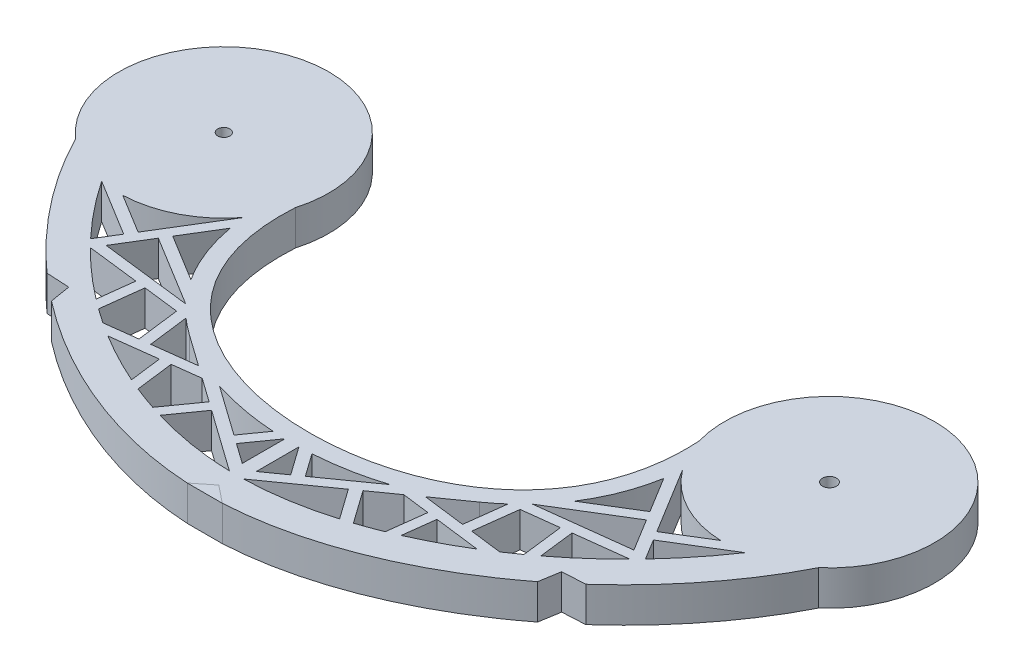
from build123d import *

# Parameters (mm, degrees)
BOSS_EXTRUDE7_DEPTH  = 10
CUT_EXTRUDE1_REACH   = 157.215
SKETCH9_R            = 1.75
SKETCH9_R_2          = 2
CUT_EXTRUDE2_DEPTH   = 3
CUT_EXTRUDE3_REACH   = 157.215
CUT_EXTRUDE4_START   = -10
CUT_EXTRUDE4_DEPTH   = 10
BOSS_EXTRUDE9_START  = -10
BOSS_EXTRUDE9_DEPTH  = 10
BOSS_EXTRUDE10_DEPTH = 10


# Read off the part's stored shape, not the designer's step: Cut-Extrude4, Boss-Extrude9
with BuildPart() as part:
    # Sketch7 → Boss-Extrude7 (new body)
    with BuildSketch(Plane(origin=(-18.136895005, 0, 47.715926566), x_dir=(1, 0, 0), z_dir=(0, 1, 0))):
        with BuildLine():
            ThreePointArc((-39.552837235, 29.351210073), (-76.890563323, 66.478444807), (-87.958625782, 14.999950833))
            add(Edge.make_bspline(
                [(-87.958625782, 14.999950833), (-68.922895336, -22.651065451), (18.136895107, -86.06931395), (105.196685549, -22.651065451), (124.232415996, 14.999950833)],
                knots=[0, 0, 0, 0, 0.5, 1, 1, 1, 1], degree=3))
            ThreePointArc((124.232415996, 14.999950833), (113.164353536, 66.478444807), (75.826627449, 29.351210073))
            add(Edge.make_bspline(
                [(-39.552837235, 29.351210073), (-41.848753724, -7.44696631), (18.136895086, -41.273411133), (78.122543939, -7.446966334), (75.826627449, 29.351210073)],
                knots=[0, 0, 0, 0, 0.5, 1, 1, 1, 1], degree=3))
        make_face()
    extrude(amount=BOSS_EXTRUDE7_DEPTH)

    # Sketch9 → Cut-Extrude1 (cut, up to next)
    with BuildSketch(Plane(origin=(0, 10, 0), x_dir=(1, 0, 0), z_dir=(0, 1, 0)), mode=Mode.PRIVATE) as cut_extrude1_sk1:
        with Locations(Location((-86.499999796, -9.999999921, 0), (0, 0, 270))):
            Circle(SKETCH9_R)
    cut_extrude1_tool1 = extrude(cut_extrude1_sk1.sketch, amount=-CUT_EXTRUDE1_REACH, mode=Mode.PRIVATE) & part.part
    # Sketch9 → Cut-Extrude1 (cut, up to next)
    with BuildSketch(Plane(origin=(0, 10, 0), x_dir=(1, 0, 0), z_dir=(0, 1, 0)), mode=Mode.PRIVATE) as cut_extrude1_sk2:
        with Locations(Location((86.5, -9.999999921, 0), (0, 0, 270))):
            Circle(SKETCH9_R_2)
    cut_extrude1_tool2 = extrude(cut_extrude1_sk2.sketch, amount=-CUT_EXTRUDE1_REACH, mode=Mode.PRIVATE) & part.part
    add(cut_extrude1_tool1.solids().sort_by_distance((-86.5, 10, 10))[0], mode=Mode.SUBTRACT)
    add(cut_extrude1_tool2.solids().sort_by_distance((86.5, 10, 10))[0], mode=Mode.SUBTRACT)

    # Sketch10 → Cut-Extrude2 (cut)
    with BuildSketch(Plane.XZ):
        Polygon((-91.11880195, 9.999999921), (-88.809400873, 5.999999921), (-84.190598719, 5.999999921), (-81.881197643, 9.999999921), (-84.190598719, 13.999999921), (-88.809400873, 13.999999921), align=None)
        Polygon((81.881197846, 9.999999921), (84.190598923, 5.999999921), (88.809401077, 5.999999921), (91.118802154, 9.999999921), (88.809401077, 13.999999921), (84.190598923, 13.999999921), align=None)
    extrude(amount=-CUT_EXTRUDE2_DEPTH, mode=Mode.SUBTRACT)

    # Sketch12 → Cut-Extrude3 (cut, up to next)
    with BuildSketch(Plane(origin=(0, 10, 0), x_dir=(1, 0, 0), z_dir=(0, 1, 0)), mode=Mode.PRIVATE) as cut_extrude3_sk1:
        with BuildLine():
            add(Edge.make_bspline(
                [(3.4e-08, -102.076116267), (1.667125354, -102.076116268), (3.334250674, -102.029606358), (5.000000038, -101.93803401)],
                knots=[0.5, 0.5, 0.5, 0.5, 0.5191492, 0.5191492, 0.5191492, 0.5191492], degree=3))
            Line((5.000000102, -101.938034007), (0, -97.938034007))
            Line((0, -97.938034007), (-4.999999898, -101.938034007))
            add(Edge.make_bspline(
                [(-4.999999898, -101.938034007), (-3.334250535, -102.029606357), (-1.667125251, -102.076116266), (3.4e-08, -102.076116267)],
                knots=[0.4808508, 0.4808508, 0.4808508, 0.4808508, 0.5, 0.5, 0.5, 0.5], degree=3))
        make_face()
    cut_extrude3_tool1 = extrude(cut_extrude3_sk1.sketch, amount=-CUT_EXTRUDE3_REACH, mode=Mode.PRIVATE) & part.part
    # Sketch12 → Cut-Extrude3 (cut, up to next)
    with BuildSketch(Plane(origin=(0, 10, 0), x_dir=(1, 0, 0), z_dir=(0, 1, 0)), mode=Mode.PRIVATE) as cut_extrude3_sk2:
        with BuildLine():
            Line((70.404630398, -70.404630398), (69.422644404, -76.312201038))
            add(Edge.make_bspline(
                [(69.422644404, -76.312201038), (72.006013328, -74.313002574), (74.516828912, -72.224047487), (76.945806504, -70.055102994)],
                knots=[0.782767442, 0.782767442, 0.782767442, 0.782767442, 0.818953202, 0.818953202, 0.818953202, 0.818953202], degree=3))
            Line((76.945806504, -70.055102994), (70.404630398, -70.404630398))
        make_face()
    cut_extrude3_tool2 = extrude(cut_extrude3_sk2.sketch, amount=-CUT_EXTRUDE3_REACH, mode=Mode.PRIVATE) & part.part
    # Sketch12 → Cut-Extrude3 (cut, up to next)
    with BuildSketch(Plane(origin=(0, 10, 0), x_dir=(1, 0, 0), z_dir=(0, 1, 0)), mode=Mode.PRIVATE) as cut_extrude3_sk3:
        with BuildLine():
            add(Edge.make_bspline(
                [(-76.945525012, -70.055354169), (-74.51654085, -72.224292711), (-72.005719037, -74.313241453), (-69.42234423, -76.312433176)],
                knots=[0.181048195, 0.181048195, 0.181048195, 0.181048195, 0.217233958, 0.217233958, 0.217233958, 0.217233958], degree=3))
            Line((-69.42234423, -76.312433176), (-70.404630305, -70.404630305))
            Line((-70.404630305, -70.404630305), (-76.945525012, -70.055354169))
        make_face()
    cut_extrude3_tool3 = extrude(cut_extrude3_sk3.sketch, amount=-CUT_EXTRUDE3_REACH, mode=Mode.PRIVATE) & part.part
    add(cut_extrude3_tool1.solids().sort_by_distance((0, 10, 100.665729))[0], mode=Mode.SUBTRACT)
    add(cut_extrude3_tool2.solids().sort_by_distance((72.284667, 10, 72.284435))[0], mode=Mode.SUBTRACT)
    add(cut_extrude3_tool3.solids().sort_by_distance((-72.284471, 10, 72.284598))[0], mode=Mode.SUBTRACT)

    # Cut-Extrude4 outline → Cut-Extrude4 (cut)
    with BuildSketch(Plane(origin=(0, 10, 0), x_dir=(1, 0, 0), z_dir=(0, 1, 0)).offset(CUT_EXTRUDE4_START)):
        with BuildLine():
            add(Edge.make_bspline(
                [(-62.548029668, -28.063492503), (-62.420996014, -29.418691097), (-61.960340191, -32.984818186), (-60.700717471, -38.475582927), (-58.550123564, -44.365643648), (-55.757526452, -49.774975806), (-51.258953922, -56.32630085), (-44.34683122, -63.248244472), (-34.509934137, -69.548404664), (-19.93792091, -75.400346503), (1.02e-07, -78.193733391), (19.937921114, -75.400346504), (34.50993434, -69.548404665), (44.346831423, -63.248244472), (51.258954126, -56.326300851), (55.757526656, -49.774975806), (58.550123767, -44.365643649), (60.700717674, -38.475582927), (61.960340395, -32.984818186), (62.420996217, -29.418691097), (62.548029872, -28.063492504)],
                knots=[0.043895539, 0.043895539, 0.043895539, 0.043895539, 0.0625, 0.09375, 0.125, 0.15625, 0.1875, 0.25, 0.3125, 0.375, 0.5, 0.625, 0.6875, 0.75, 0.8125, 0.84375, 0.875, 0.90625, 0.9375, 0.956104461, 0.956104461, 0.956104461, 0.956104461], degree=3))
            ThreePointArc((-62.548029668, -28.063492503), (-75.592334586, -37.946546701), (-91.88267132, -39.5129375))
            add(Edge.make_bspline(
                [(-91.88267132, -39.5129375), (-91.655822009, -39.851586045), (-90.004404189, -42.28867412), (-86.726494545, -46.751749001), (-80.05790908, -54.718890052), (-70.683342588, -64.025971484), (-58.066702471, -73.829661616), (-44.383796741, -81.958439403), (-29.94274555, -88.114356187), (-15.039263517, -92.015520635), (9.5e-08, -93.399252924), (15.039263711, -92.01552063), (29.942745747, -88.114356182), (44.383796942, -81.958439398), (58.066702676, -73.829661613), (70.683342795, -64.025971483), (80.057909288, -54.718890053), (86.726494752, -46.751749003), (90.004404396, -42.288674121), (91.655822216, -39.851586046), (91.882671528, -39.5129375)],
                knots=[0.057469583, 0.057469583, 0.057469583, 0.057469583, 0.0625, 0.09375, 0.125, 0.1875, 0.25, 0.3125, 0.375, 0.4375, 0.5, 0.5625, 0.625, 0.6875, 0.75, 0.8125, 0.875, 0.90625, 0.9375, 0.942530417, 0.942530417, 0.942530417, 0.942530417], degree=3))
            ThreePointArc((91.882671528, -39.5129375), (75.592334792, -37.946546702), (62.548029872, -28.063492504))
        make_face()
    extrude(amount=CUT_EXTRUDE4_DEPTH, mode=Mode.SUBTRACT)

    # Boss-Extrude9 outline → Boss-Extrude9 (add)
    with BuildSketch(Plane.XZ.offset(BOSS_EXTRUDE9_START)):
        with BuildLine():
            add(Edge.make_bspline(
                [(61.910673514, 32.76758616), (61.953077476, 32.530509461), (62.2176064, 30.993215728), (62.420996217, 29.418691097), (62.548029872, 28.063492504)],
                knots=[0.934092605, 0.934092605, 0.934092605, 0.934092605, 0.9375, 0.956104461, 0.956104461, 0.956104461, 0.956104461], degree=3))
            Line((62.548029872, 28.063492504), (70.312543244, 40.744221841))
            Line((70.312543244, 40.744221841), (67.860554837, 42.48472245))
            Line((67.860554837, 42.48472245), (61.910673514, 32.76758616))
        make_face()
        with BuildLine():
            Line((67.860554837, 42.48472245), (70.312543244, 40.744221841))
            Line((70.312543244, 40.744221841), (71.882737903, 43.308608368))
            Line((71.882737903, 43.308608368), (63.059802029, 49.571413368))
            Line((63.059802029, 49.571413368), (49.524010805, 57.859488104))
            add(Edge.make_bspline(
                [(49.524010805, 57.859488104), (50.491241977, 56.818898763), (52.013790041, 55.034628627), (53.413433174, 53.129522246), (53.941879538, 52.364647964)],
                knots=[0.789770891, 0.789770891, 0.789770891, 0.789770891, 0.8125, 0.827144885, 0.827144885, 0.827144885, 0.827144885], degree=3))
            Line((53.941879538, 52.364647964), (61.406362532, 47.066116718))
            Line((61.406362532, 47.066116718), (68.140869962, 42.942523223))
            Line((68.140869962, 42.942523223), (67.860554837, 42.48472245))
        make_face()
        with BuildLine():
            Line((63.059802029, 49.571413368), (71.882737903, 43.308608368))
            Line((71.882737903, 43.308608368), (74.079486631, 46.896260897))
            Line((74.079486631, 46.896260897), (85.376924602, 39.978748043))
            ThreePointArc((85.376924602, 39.978748043), (88.642494962, 39.923174095), (91.882671528, 39.5129375))
            Line((91.882671528, 39.5129375), (75.646065835, 49.454742791))
            Line((75.646065835, 49.454742791), (79.238009146, 55.320977897))
            add(Edge.make_bspline(
                [(77.085158054, 57.550018933), (77.812810631, 56.814476331), (78.530552386, 56.071326563), (79.238009146, 55.320977897)],
                knots=[0.848457328, 0.848457328, 0.848457328, 0.848457328, 0.860751313, 0.860751313, 0.860751313, 0.860751313], degree=3))
            Line((77.085158054, 57.550018933), (62.30055363, 59.337027727))
            Line((62.30055363, 59.337027727), (63.526406136, 69.478972429))
            add(Edge.make_bspline(
                [(60.753613666, 71.539393839), (61.686928783, 70.865010822), (62.61136355, 70.178027853), (63.526406136, 69.478972429)],
                knots=[0.763740362, 0.763740362, 0.763740362, 0.763740362, 0.777297489, 0.777297489, 0.777297489, 0.777297489], degree=3))
            Line((60.753613666, 71.539393839), (59.322230581, 59.697016356))
            Line((59.322230581, 59.697016356), (49.059623661, 60.937453251))
            Line((49.059623661, 60.937453251), (47.521689417, 73.218979202))
            Line((47.521689417, 73.218979202), (56.678688826, 74.365649657))
            add(Edge.make_bspline(
                [(52.720969648, 76.89348052), (54.054428795, 76.076490632), (55.374110034, 75.233453407), (56.678688826, 74.365649657)],
                knots=[0.725802392, 0.725802392, 0.725802392, 0.725802392, 0.744268631, 0.744268631, 0.744268631, 0.744268631], degree=3))
            Line((52.720969648, 76.89348052), (39.644319543, 75.255978138))
            Line((39.644319543, 75.255978138), (38.504682603, 84.356809797))
            add(Edge.make_bspline(
                [(35.312430399, 85.704979344), (36.38137701, 85.272992874), (37.445639574, 84.823432873), (38.504682603, 84.356809797)],
                knots=[0.648350173, 0.648350173, 0.648350173, 0.648350173, 0.662192937, 0.662192937, 0.662192937, 0.662192937], degree=3))
            Line((35.312430399, 85.704979344), (36.667567826, 74.883219214))
            Line((36.667567826, 74.883219214), (28.790554188, 73.896832908))
            Line((28.790554188, 73.896832908), (21.975602666, 78.734305726))
            Line((21.975602666, 78.734305726), (28.655663299, 88.145064421))
            add(Edge.make_bspline(
                [(25.644375868, 89.085672491), (26.650854425, 88.788194719), (27.654771272, 88.474534556), (28.655663299, 88.145064421)],
                knots=[0.60709377, 0.60709377, 0.60709377, 0.60709377, 0.619852225, 0.619852225, 0.619852225, 0.619852225], degree=3))
            Line((25.644375868, 89.085672491), (19.529260089, 80.470798742))
            Line((19.529260089, 80.470798742), (7.312058681, 89.142963106))
            Line((7.312058681, 89.142963106), (4.529478726, 87.439166842))
            Line((4.529478726, 87.439166842), (7.74987471, 85.153225704))
            Line((7.74987471, 85.153225704), (5.160775487, 81.505745635))
            Line((5.160775487, 81.505745635), (7.725162012, 79.935550976))
            Line((7.725162012, 79.935550976), (10.196217287, 83.416732688))
            Line((10.196217287, 83.416732688), (24.384906033, 73.345142892))
            add(Edge.make_bspline(
                [(24.384906033, 73.345142892), (27.818061162, 72.233164071), (33.742434167, 69.801754713), (39.181479233, 66.521018641), (41.441449948, 64.916818424)],
                knots=[0.630106953, 0.630106953, 0.630106953, 0.630106953, 0.6875, 0.732163186, 0.732163186, 0.732163186, 0.732163186], degree=3))
            Line((41.441449948, 64.916818424), (32.411186743, 71.326790919))
            Line((32.411186743, 71.326790919), (44.5449377, 72.846220278))
            Line((44.5449377, 72.846220278), (45.937530045, 61.725355335))
            Line((45.937530045, 61.725355335), (51.765353147, 57.588578168))
            Line((51.765353147, 57.588578168), (75.362366879, 54.736417243))
            Line((75.362366879, 54.736417243), (69.707449174, 45.50100513))
            Line((69.707449174, 45.50100513), (63.059802029, 49.571413368))
        make_face()
        with BuildLine():
            add(Edge.make_bspline(
                [(53.941879538, 52.364647964), (54.222114996, 51.959034624), (54.496726218, 51.548256928), (54.765544957, 51.132343135)],
                knots=[0.827144885, 0.827144885, 0.827144885, 0.827144885, 0.834911077, 0.834911077, 0.834911077, 0.834911077], degree=3))
            Line((54.765544957, 51.132343135), (61.406362532, 47.066116718))
            Line((61.406362532, 47.066116718), (53.941879538, 52.364647964))
        make_face()
        with BuildLine():
            add(Edge.make_bspline(
                [(45.989728781, 61.308510333), (47.219261835, 60.218828517), (48.399538628, 59.069244154), (49.524010805, 57.859488104)],
                knots=[0.763346753, 0.763346753, 0.763346753, 0.763346753, 0.789770891, 0.789770891, 0.789770891, 0.789770891], degree=3))
            Line((49.524010805, 57.859488104), (51.765353147, 57.588578168))
            Line((51.765353147, 57.588578168), (45.937530045, 61.725355335))
            Line((45.937530045, 61.725355335), (45.989728781, 61.308510333))
        make_face()
        with BuildLine():
            add(Edge.make_bspline(
                [(1.999999836, 77.052897294), (3.189965786, 77.024917048), (4.379075889, 76.971876112), (5.565802091, 76.893480512)],
                knots=[0.510450501, 0.510450501, 0.510450501, 0.510450501, 0.529109125, 0.529109125, 0.529109125, 0.529109125], degree=3))
            Line((5.565802091, 76.893480512), (7.725162012, 79.935550976))
            Line((7.725162012, 79.935550976), (5.160775487, 81.505745635))
            Line((5.160775487, 81.505745635), (1.999999836, 77.052897294))
        make_face()
        with BuildLine():
            add(Edge.make_bspline(
                [(-1.999999834, 77.052897289), (-1.333512175, 77.068568738), (3.5e-08, 77.084188534), (1.333512244, 77.068568739), (1.999999836, 77.052897294)],
                knots=[0.489549498, 0.489549498, 0.489549498, 0.489549498, 0.5, 0.510450501, 0.510450501, 0.510450501, 0.510450501], degree=3))
            Line((1.999999836, 77.052897294), (1.999999835, 83.44111419))
            Line((1.999999835, 83.44111419), (3e-09, 84.665730301))
            Line((3e-09, 84.665730301), (-1.999999835, 83.441114186))
            Line((-1.999999835, 83.441114186), (-1.999999834, 77.052897289))
        make_face()
        with BuildLine():
            Line((-7.72516201, 79.935550974), (-5.565802081, 76.893480499))
            add(Edge.make_bspline(
                [(-5.565802081, 76.893480499), (-4.379075882, 76.971876101), (-3.189965781, 77.02491704), (-1.999999834, 77.052897289)],
                knots=[0.470890874, 0.470890874, 0.470890874, 0.470890874, 0.489549498, 0.489549498, 0.489549498, 0.489549498], degree=3))
            Line((-1.999999834, 77.052897289), (-5.160775485, 81.505745632))
            Line((-5.160775485, 81.505745632), (-7.72516201, 79.935550974))
        make_face()
        Polygon((3e-09, 84.665730301), (1.999999835, 83.44111419), (1.999999835, 85.890346411), align=None)
        with BuildLine():
            Line((-10.196217287, 83.416732688), (-7.72516201, 79.935550974))
            Line((-7.72516201, 79.935550974), (-5.160775485, 81.505745632))
            Line((-5.160775485, 81.505745632), (-7.74987471, 85.153225704))
            Line((-7.74987471, 85.153225704), (-4.529478722, 87.439166844))
            Line((-4.529478722, 87.439166844), (-7.312058677, 89.142963108))
            Line((-7.312058677, 89.142963108), (-19.529260089, 80.470798742))
            Line((-19.529260089, 80.470798742), (-25.644375837, 89.085672448))
            add(Edge.make_bspline(
                [(-28.655663265, 88.145064373), (-27.654771239, 88.474534509), (-26.650854393, 88.788194673), (-25.644375837, 89.085672448)],
                knots=[0.380147775, 0.380147775, 0.380147775, 0.380147775, 0.392906229, 0.392906229, 0.392906229, 0.392906229], degree=3))
            Line((-28.655663265, 88.145064373), (-21.975602666, 78.734305726))
            Line((-21.975602666, 78.734305726), (-28.790554188, 73.896832908))
            Line((-28.790554188, 73.896832908), (-36.667567826, 74.883219214))
            Line((-36.667567826, 74.883219214), (-35.31243041, 85.704979264))
            add(Edge.make_bspline(
                [(-38.504682614, 84.356809709), (-37.445639585, 84.823432788), (-36.381377021, 85.272992792), (-35.31243041, 85.704979264)],
                knots=[0.337807062, 0.337807062, 0.337807062, 0.337807062, 0.351649826, 0.351649826, 0.351649826, 0.351649826], degree=3))
            Line((-38.504682614, 84.356809709), (-39.644319543, 75.255978138))
            Line((-39.644319543, 75.255978138), (-52.720969493, 76.893480494))
            add(Edge.make_bspline(
                [(-56.678688658, 74.365649637), (-55.37410987, 75.233453384), (-54.054428637, 76.076490607), (-52.720969493, 76.893480494)],
                knots=[0.255731369, 0.255731369, 0.255731369, 0.255731369, 0.274197608, 0.274197608, 0.274197608, 0.274197608], degree=3))
            Line((-56.678688658, 74.365649637), (-47.521689417, 73.218979202))
            Line((-47.521689417, 73.218979202), (-49.059623661, 60.937453251))
            Line((-49.059623661, 60.937453251), (-59.322230581, 59.697016356))
            Line((-59.322230581, 59.697016356), (-60.753613651, 71.539393705))
            add(Edge.make_bspline(
                [(-63.526406118, 69.478972288), (-62.611363532, 70.178027714), (-61.686928766, 70.865010685), (-60.753613651, 71.539393705)],
                knots=[0.22270251, 0.22270251, 0.22270251, 0.22270251, 0.236259637, 0.236259637, 0.236259637, 0.236259637], degree=3))
            Line((-63.526406118, 69.478972288), (-62.30055363, 59.337027727))
            Line((-62.30055363, 59.337027727), (-77.085157817, 57.550018962))
            add(Edge.make_bspline(
                [(-79.238008941, 55.320977894), (-78.53055217, 56.07132657), (-77.812810405, 56.81447635), (-77.085157817, 57.550018962)],
                knots=[0.139248687, 0.139248687, 0.139248687, 0.139248687, 0.151542672, 0.151542672, 0.151542672, 0.151542672], degree=3))
            Line((-79.238008941, 55.320977894), (-75.64606563, 49.454742789))
            Line((-75.64606563, 49.454742789), (-91.88267132, 39.5129375))
            ThreePointArc((-91.88267132, 39.5129375), (-88.642494755, 39.923174095), (-85.376924395, 39.978748042))
            Line((-85.376924395, 39.978748042), (-74.079486426, 46.896260896))
            Line((-74.079486426, 46.896260896), (-71.88273776, 43.308608468))
            Line((-71.88273776, 43.308608468), (-63.059802018, 49.571413374))
            Line((-63.059802018, 49.571413374), (-69.707449026, 45.501005221))
            Line((-69.707449026, 45.501005221), (-75.36236669, 54.736417266))
            Line((-75.36236669, 54.736417266), (-51.765353147, 57.588578168))
            Line((-51.765353147, 57.588578168), (-45.937530045, 61.725355334))
            Line((-45.937530045, 61.725355334), (-44.5449377, 72.846220278))
            Line((-44.5449377, 72.846220278), (-32.411186743, 71.326790919))
            Line((-32.411186743, 71.326790919), (-41.441449319, 64.916818726))
            add(Edge.make_bspline(
                [(-41.441449319, 64.916818726), (-39.18147873, 66.52101882), (-33.74243392, 69.801754707), (-27.818061219, 72.233163964), (-24.384906233, 73.345142761)],
                knots=[0.267836817, 0.267836817, 0.267836817, 0.267836817, 0.3125, 0.369893044, 0.369893044, 0.369893044, 0.369893044], degree=3))
            Line((-24.384906233, 73.345142761), (-10.196217287, 83.416732688))
        make_face()
        with BuildLine():
            Line((3e-09, 84.665730301), (1.999999835, 85.890346411))
            Line((1.999999835, 85.890346411), (1.999999835, 89.234672699))
            Line((1.999999835, 89.234672699), (4.529478726, 87.439166842))
            Line((4.529478726, 87.439166842), (7.312058681, 89.142963106))
            Line((7.312058681, 89.142963106), (1.99999983, 92.913634139))
            add(Edge.make_bspline(
                [(-1.999999846, 92.913634134), (-1.333368684, 92.929851258), (2.7e-08, 92.946166395), (1.333368737, 92.929851259), (1.99999983, 92.913634139)],
                knots=[0.491688202, 0.491688202, 0.491688202, 0.491688202, 0.5, 0.508311797, 0.508311797, 0.508311797, 0.508311797], degree=3))
            Line((-1.999999846, 92.913634134), (-7.312058677, 89.142963108))
            Line((-7.312058677, 89.142963108), (-4.529478722, 87.439166844))
            Line((-4.529478722, 87.439166844), (-1.999999835, 89.234672699))
            Line((-1.999999835, 89.234672699), (-1.999999835, 85.890346415))
            Line((-1.999999835, 85.890346415), (3e-09, 84.665730301))
        make_face()
        Polygon((-1.999999835, 83.441114186), (3e-09, 84.665730301), (-1.999999835, 85.890346415), align=None)
        with BuildLine():
            Line((-61.406362527, 47.06611672), (-54.765544596, 51.132343378))
            add(Edge.make_bspline(
                [(-54.765544596, 51.132343378), (-54.496725845, 51.548257184), (-54.22211461, 51.959034894), (-53.941879138, 52.364648247)],
                knots=[0.165088925, 0.165088925, 0.165088925, 0.165088925, 0.172855117, 0.172855117, 0.172855117, 0.172855117], degree=3))
            Line((-53.941879138, 52.364648247), (-61.406362527, 47.06611672))
        make_face()
        with BuildLine():
            add(Edge.make_bspline(
                [(-62.548029668, 28.063492503), (-62.420996014, 29.418691097), (-62.217606196, 30.993215726), (-61.953077273, 32.530509457), (-61.910673311, 32.767586155)],
                knots=[0.043895539, 0.043895539, 0.043895539, 0.043895539, 0.0625, 0.065907395, 0.065907395, 0.065907395, 0.065907395], degree=3))
            Line((-61.910673311, 32.767586155), (-67.860554695, 42.48472255))
            Line((-67.860554695, 42.48472255), (-70.312543102, 40.744221942))
            Line((-70.312543102, 40.744221942), (-62.548029668, 28.063492503))
        make_face()
        with BuildLine():
            Line((-68.140869814, 42.942523314), (-61.406362527, 47.06611672))
            Line((-61.406362527, 47.06611672), (-53.941879138, 52.364648247))
            add(Edge.make_bspline(
                [(-53.941879138, 52.364648247), (-53.413432835, 53.12952243), (-52.013789699, 55.034628801), (-50.491241634, 56.818898927), (-49.524010383, 57.859488338)],
                knots=[0.172855117, 0.172855117, 0.172855117, 0.172855117, 0.1875, 0.210229111, 0.210229111, 0.210229111, 0.210229111], degree=3))
            Line((-49.524010383, 57.859488338), (-63.059802018, 49.571413374))
            Line((-63.059802018, 49.571413374), (-71.88273776, 43.308608468))
            Line((-71.88273776, 43.308608468), (-70.312543102, 40.744221942))
            Line((-70.312543102, 40.744221942), (-67.860554695, 42.48472255))
            Line((-67.860554695, 42.48472255), (-68.140869814, 42.942523314))
        make_face()
        with BuildLine():
            add(Edge.make_bspline(
                [(-49.524010383, 57.859488338), (-48.399538343, 59.069244225), (-47.219261702, 60.21882844), (-45.989728813, 61.308510124)],
                knots=[0.210229111, 0.210229111, 0.210229111, 0.210229111, 0.236653246, 0.236653246, 0.236653246, 0.236653246], degree=3))
            Line((-45.989728813, 61.308510124), (-45.937530045, 61.725355334))
            Line((-45.937530045, 61.725355334), (-51.765353147, 57.588578168))
            Line((-51.765353147, 57.588578168), (-49.524010383, 57.859488338))
        make_face()
    extrude(amount=BOSS_EXTRUDE9_DEPTH)


with BuildPart() as body_2:
    # Sketch16 → Boss-Extrude10 (new body)
    with BuildSketch(Plane(origin=(0, 10, 0), x_dir=(1, 0, 0), z_dir=(0, 1, 0))):
        Polygon((-4.999999889, -101.938034007), (0, -97.938034007), (5.000000101, -101.938034007), align=None)
    extrude(amount=-BOSS_EXTRUDE10_DEPTH)


solid = Compound([part.part, body_2.part])
